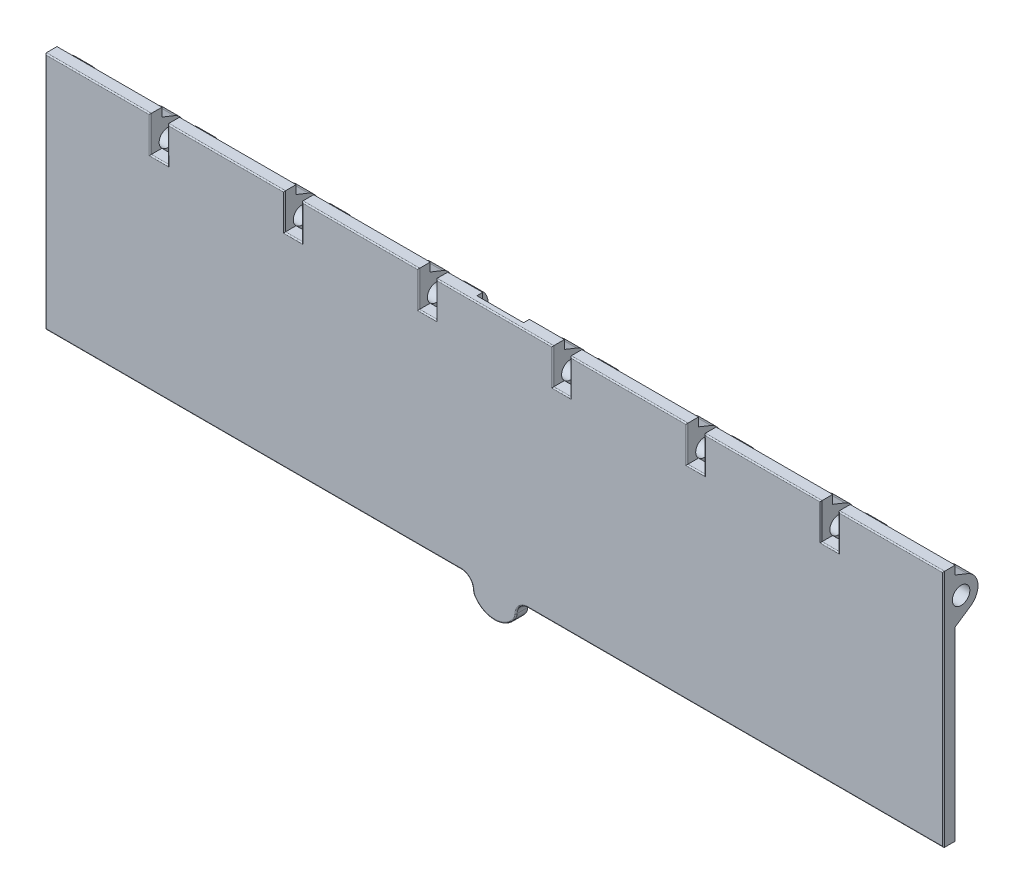
from build123d import *

# Parameters (mm, degrees)
SKETCH1_W           = 154
SKETCH1_H           = 41
BOSS_EXTRUDE1_DEPTH = 2
SKETCH2_R           = 1.5
CUT_EXTRUDE1_DEPTH  = 204
SKETCH3_R           = 1.5
BOSS_EXTRUDE2_DEPTH = 154
SKETCH4_W           = 12
SKETCH4_H           = 23.161381141
SKETCH4_W_2         = 3
SKETCH4_H_2         = 18.642875374
SKETCH4_H_3         = 14.783247827
SKETCH4_W_3         = 14
SKETCH4_H_4         = 17.598544921
SKETCH4_H_5         = 27.804183012
CUT_EXTRUDE2_DEPTH  = 204
SKETCH5_W           = 3
SKETCH5_H           = 13.316127407
CUT_EXTRUDE3_DEPTH  = 5
SKETCH6_W           = 8
SKETCH6_H           = 34.567606234
CUT_EXTRUDE4_DEPTH  = 1
SKETCH7_W           = 10.416873331
SKETCH7_H           = 25.160109374
BOSS_EXTRUDE3_DEPTH = 1
FILLET1_R           = 10
BOSS_EXTRUDE4_DEPTH = 2
FILLET2_R           = 2
FILLET3_R           = 2
FILLET4_R           = 0.2


with BuildPart() as part:
    # Sketch1 → Boss-Extrude1 (new body)
    with BuildSketch(Plane.XY):
        with Locations((46, -32.5)):
            Rectangle(SKETCH1_W, SKETCH1_H)
    extrude(amount=BOSS_EXTRUDE1_DEPTH)

    # Sketch2 → Cut-Extrude1 (cut)
    with BuildSketch(Plane.ZY.offset(31)):
        with Locations((-1, -17)):
            Circle(SKETCH2_R)
    extrude(amount=-CUT_EXTRUDE1_DEPTH, mode=Mode.SUBTRACT)

    # Sketch3 → Boss-Extrude2 (add)
    with BuildSketch(Plane.ZY.offset(31)):
        with BuildLine():
            Line((-2.639541446, -19.403784927), (0, -21.185182296))
            Line((0, -21.185182296), (0, -19.715731065))
            ThreePointArc((0, -19.715731065), (1.882746452, -17), (0, -14.284268935))
            Line((0, -14.284268935), (0, -13.471330145))
            Line((0, -13.471330145), (-2.092481561, -14.306696319))
            ThreePointArc((-2.092481561, -14.306696319), (-3.900693524, -16.690526404), (-2.639541446, -19.403784927))
        make_face()
        with Locations((-1.017253548, -17)):
            Circle(SKETCH3_R, mode=Mode.SUBTRACT)
    extrude(amount=-BOSS_EXTRUDE2_DEPTH)

    # Sketch4 → Cut-Extrude2 (cut)
    with BuildSketch(Plane(origin=(0, 0, 0), x_dir=(-1, 0, 0), z_dir=(0, 0, -1))):
        with Locations((22, -9.604491726)):
            Rectangle(SKETCH4_W, SKETCH4_H)
        with Locations((-80.5, -11.863744609)):
            Rectangle(SKETCH4_W_2, SKETCH4_H_2)
        with Locations((-114, -13.793558383)):
            Rectangle(SKETCH4_W, SKETCH4_H_3)
        with Locations((-103.5, -11.863744609)):
            Rectangle(SKETCH4_W_2, SKETCH4_H_2)
        with Locations((-92, -12.385909835)):
            Rectangle(SKETCH4_W_3, SKETCH4_H_4)
        with Locations((-69, -12.385909835)):
            Rectangle(SKETCH4_W_3, SKETCH4_H_4)
        with Locations((-57.5, -11.863744609)):
            Rectangle(SKETCH4_W_2, SKETCH4_H_2)
        with Locations((-46, -12.385909835)):
            Rectangle(SKETCH4_W_3, SKETCH4_H_4)
        with Locations((-34.5, -11.863744609)):
            Rectangle(SKETCH4_W_2, SKETCH4_H_2)
        with Locations((-23, -12.385909835)):
            Rectangle(SKETCH4_W_3, SKETCH4_H_4)
        with Locations((-11.5, -11.863744609)):
            Rectangle(SKETCH4_W_2, SKETCH4_H_2)
        with Locations((0, -12.385909835)):
            Rectangle(SKETCH4_W_3, SKETCH4_H_4)
        with Locations((11.5, -7.28309079)):
            Rectangle(SKETCH4_W_2, SKETCH4_H_5)
    extrude(amount=CUT_EXTRUDE2_DEPTH, mode=Mode.SUBTRACT)

    # Sketch5 → Cut-Extrude3 (cut)
    with BuildSketch(Plane(origin=(0, 0, 0), x_dir=(-1, 0, 0), z_dir=(0, 0, -1))):
        with Locations((-80.5, -11.44429523)):
            Rectangle(SKETCH5_W, SKETCH5_H)
        with Locations((-103.5, -11.44429523)):
            Rectangle(SKETCH5_W, SKETCH5_H)
        with Locations((-57.5, -11.44429523)):
            Rectangle(SKETCH5_W, SKETCH5_H)
        with Locations((-34.5, -11.44429523)):
            Rectangle(SKETCH5_W, SKETCH5_H)
        with Locations((-11.5, -11.44429523)):
            Rectangle(SKETCH5_W, SKETCH5_H)
        with Locations((11.5, -11.44429523)):
            Rectangle(SKETCH5_W, SKETCH5_H)
    extrude(amount=-CUT_EXTRUDE3_DEPTH, mode=Mode.SUBTRACT)

    # Sketch6 → Cut-Extrude4 (cut)
    with BuildSketch(Plane(origin=(0, 0, 0), x_dir=(-1, 0, 0), z_dir=(0, 0, -1))):
        with Locations((-46, -29.283803117)):
            Rectangle(SKETCH6_W, SKETCH6_H)
    extrude(amount=-CUT_EXTRUDE4_DEPTH, mode=Mode.SUBTRACT)

    # Sketch7 → Boss-Extrude3 (add)
    with BuildSketch(Plane(origin=(0, 0, 0), x_dir=(-1, 0, 0), z_dir=(0, 0, -1))):
        with Locations((-46.159585617, -34.952904223)):
            Rectangle(SKETCH7_W, SKETCH7_H)
    extrude(amount=BOSS_EXTRUDE3_DEPTH)

    # Fillet1
    # the kernel refuses this fillet: 10 mm, written as the material it takes off along each edge
    with BuildSketch(Plane(origin=(40.951148952, -11.475602177, -1), x_dir=(0, 0, 1), z_dir=(0, -1, 0)), Plane(origin=(51.368022283, -58.430206269, -1), x_dir=(0, 0, 1), z_dir=(0, 1, 0))) as fillet1_piece_1:
        with BuildLine():
            CenterArc((10, -4.358898944), FILLET1_R, 154.158067237, 25.841932763)
            Line((0, -4.358898944), (-0.2, -4.358898944))
            Line((-0.2, -4.358898944), (-0.2, 0))
            Line((-0.2, 0), (0, 0.2))
            ThreePointArc((0, 0.2), (0.5, 0.2), (0.82, 0.087177979))
            Line((0.82, 0.087177979), (1, 0))
        make_face()
    extrude(amount=46.954604092, mode=Mode.SUBTRACT)
    with BuildSketch(Plane(origin=(30.053901593, -47.53295891, -1), x_dir=(0, 0, 1), z_dir=(1, 0, 0))) as fillet1_piece_2:
        with BuildLine():
            CenterArc((10, -4.358898944), FILLET1_R, 154.158067237, 25.841932763)
            Line((0, -4.358898944), (-0.2, -4.358898944))
            Line((-0.2, -4.358898944), (-0.2, 0))
            Line((-0.2, 0), (0, 0.2))
            ThreePointArc((0, 0.2), (0.5, 0.2), (0.82, 0.087177979))
            Line((0.82, 0.087177979), (1, 0))
        make_face()
    extrude(amount=32.211368048, mode=Mode.SUBTRACT)

    # Sketch8 → Boss-Extrude4 (add)
    with BuildSketch(Plane.XY.offset(2)):
        with BuildLine():
            Line((42.287250182, -53), (49.726428085, -53))
            Line((49.726428085, -53), (49.726428085, -55.335034312))
            ThreePointArc((49.726428085, -55.335034312), (46.006839134, -57.703773476), (42.287250182, -55.335034312))
            Line((42.287250182, -55.335034312), (42.287250182, -53))
        make_face()
    extrude(amount=-BOSS_EXTRUDE4_DEPTH)

    # Fillet2
    fillet2_edges = [part.edges().sort_by_distance(p)[0] for p in [
        (49.726428085, -53, 1),
        (42.287250182, -53, 1),
    ]]
    fillet(fillet2_edges, radius=FILLET2_R)

    # Fillet3
    fillet3_edges = [part.edges().sort_by_distance(p)[0] for p in [
        (42.287250182, -55.335034312, 1),
        (49.726428085, -55.335034312, 1),
    ]]
    fillet(fillet3_edges, radius=FILLET3_R)

    # Fillet4
    fillet4_edges = [part.edges().sort_by_distance(p)[0] for p in [
        (123, -32.5, 2),
        (87.363214043, -53, 2),
        (-31, -32.5, 2),
        (-22, -12, 2),
        (0, -12, 2),
        (23, -12, 2),
        (46, -12, 2),
        (69, -12, 2),
        (92, -12, 2),
        (114, -12, 2),
        (-13, -15.051179467, 2),
        (-11.5, -18.102358934, 2),
        (-10, -15.051179467, 2),
        (10, -15.051179467, 2),
        (11.5, -18.102358934, 2),
        (13, -15.051179467, 2),
        (33, -15.051179467, 2),
        (34.5, -18.102358934, 2),
        (36, -15.051179467, 2),
        (56, -15.051179467, 2),
        (57.5, -18.102358934, 2),
        (59, -15.051179467, 2),
        (79, -15.051179467, 2),
        (80.5, -18.102358934, 2),
        (82, -15.051179467, 2),
        (103.5, -18.102358934, 2),
        (102, -15.051179467, 2),
        (105, -15.051179467, 2),
        (4.643625091, -53, 2),
        (41.666744603, -53.551899471, 2),
        (46.006839134, -57.703773476, 2),
        (50.346933665, -53.551899471, 2),
        (49.623464755, -55.453379515, 2),
        (42.390213513, -55.453379515, 2),
    ]]
    fillet(fillet4_edges, radius=FILLET4_R)


solid = part.part
